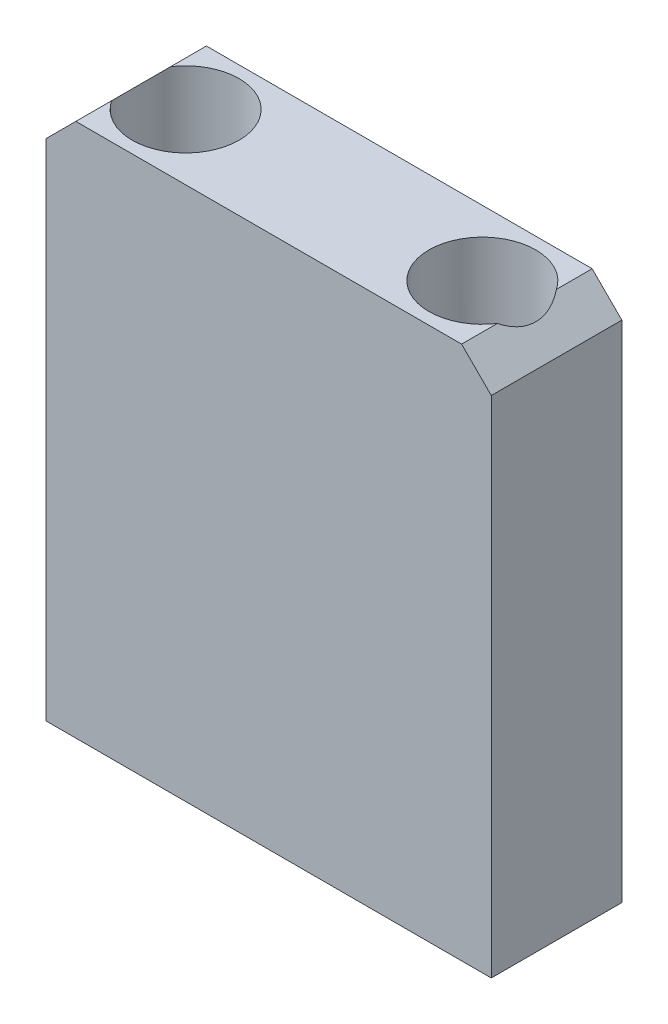
from build123d import *

# Parameters (mm, degrees)
SKETCH1_W                                        = 75
SKETCH1_H                                        = 90
BOSS_EXTRUDE1_DEPTH                              = 22
CBORE_FOR_M10_SOCKET_HEAD_CAP_SCREW1_D           = 12
CBORE_FOR_M10_SOCKET_HEAD_CAP_SCREW1_CBORE_D     = 18
CBORE_FOR_M10_SOCKET_HEAD_CAP_SCREW1_CBORE_DEPTH = 31
CHAMFER1_SIZE                                    = 5


with BuildPart() as part:
    # Sketch1 → Boss-Extrude1 (new body)
    with BuildSketch(Plane.XY):
        with Locations((0, 45)):
            Rectangle(SKETCH1_W, SKETCH1_H)
    extrude(amount=BOSS_EXTRUDE1_DEPTH)

    # CBORE for M10 Socket Head Cap Screw1 (through all)
    with Locations(Plane(origin=(0, 90, 0), x_dir=(-1, 0, 0), z_dir=(0, 1, 0))):
        with Locations((25, 11), (-25, 11)):
            CounterBoreHole(CBORE_FOR_M10_SOCKET_HEAD_CAP_SCREW1_D / 2, CBORE_FOR_M10_SOCKET_HEAD_CAP_SCREW1_CBORE_D / 2, CBORE_FOR_M10_SOCKET_HEAD_CAP_SCREW1_CBORE_DEPTH)

    # Chamfer1
    # the kernel refuses this chamfer: 5 mm, written as the material it takes off along each edge
    with BuildSketch(Plane(origin=(-37.5, 90, -12.85841494), x_dir=(-0.027495876610586282, -0.9996219169112968, 0), z_dir=(0, 0, 1))) as chamfer1_piece_1:
        Polygon((CHAMFER1_SIZE * 0.999621916911, CHAMFER1_SIZE * 0.0274958766106), (-CHAMFER1_SIZE * 0.0274958766106, CHAMFER1_SIZE * 0.999621916911), (0, 0), align=None)
    extrude(amount=47.71682988, mode=Mode.SUBTRACT)
    with BuildSketch(Plane(origin=(37.5, 90, -12.85841494), x_dir=(0.027495876610586282, -0.9996219169112968, 0), z_dir=(0, 0, 1))) as chamfer1_piece_2:
        Polygon((CHAMFER1_SIZE * 0.999621916911, -CHAMFER1_SIZE * 0.0274958766106), (-CHAMFER1_SIZE * 0.0274958766106, -CHAMFER1_SIZE * 0.999621916911), (0, 0), align=None)
    extrude(amount=47.71682988, mode=Mode.SUBTRACT)


solid = part.part
